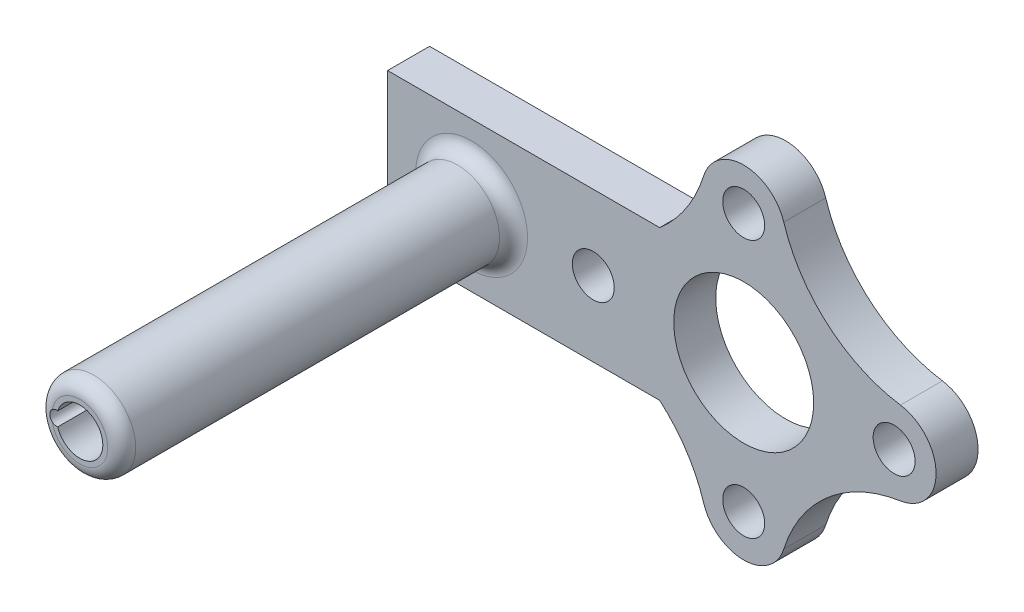
from build123d import *

# Parameters (mm, degrees)
SKETCH1_R                = 1.5
SKETCH1_R_2              = 5
SKETCH1_R_3              = 3
BOSS_EXTRUDE1_DEPTH      = 3
SKETCH2_W                = 19.444746102
SKETCH2_H                = 10.693884422
SKETCH2_R                = 3
SKETCH2_R_2              = 1.5
BOSS_EXTRUDE2_DEPTH      = 3
BOSS_EXTRUDE3_DEPTH      = 28
BOSS_EXTRUDE3_DEPTH_BACK = 3
SKETCH3_R                = 3
SKETCH3_R_2              = 1.65
SKETCH4_R                = 0.5
CUT_EXTRUDE1_DEPTH       = 30
SKETCH5_R                = 3
CUT_EXTRUDE2_DEPTH       = 2
CHAMFER1_SIZE            = 1
FILLET2_R                = 1
FILLET3_R                = 1


with BuildPart() as part:
    # Sketch1 → Boss-Extrude1 (new body)
    # profile 1 of 4: a face of its own
    with BuildSketch(Plane.XY):
        with BuildLine():
            ThreePointArc((2.863548114, 10.119478732), (2.965690842, 9.677413339), (3, 9.225))
            ThreePointArc((3, 9.225), (-0.452413339, 6.259309158), (-2.863548114, 10.119478732))
            ThreePointArc((-2.863548114, 10.119478732), (-6.005253898, 5.346942211), (-11.199408085, 2.966147733))
            ThreePointArc((-11.199408085, 2.966147733), (-8.794012303, 2.274667476), (-7.75, 0))
            ThreePointArc((-7.75, 0), (-8.794012303, -2.274667476), (-11.199408085, -2.966147733))
            ThreePointArc((-11.199408085, -2.966147733), (-6.005253898, -5.346942211), (-2.863548114, -10.119478732))
            ThreePointArc((-2.863548114, -10.119478732), (0, -12.225), (2.863548114, -10.119478732))
            ThreePointArc((2.863548114, -10.119478732), (6.005253898, -5.346942211), (11.199408085, -2.966147733))
            ThreePointArc((11.199408085, -2.966147733), (7.75, 0), (11.199408085, 2.966147733))
            ThreePointArc((11.199408085, 2.966147733), (6.005253898, 5.346942211), (2.863548114, 10.119478732))
        make_face()
        with Locations((0, -9.225)):
            Circle(SKETCH1_R, mode=Mode.SUBTRACT)
        Circle(SKETCH1_R_2, mode=Mode.SUBTRACT)
    # profile 2 of 4: a face of its own
    with BuildSketch(Plane.XY):
        with Locations((0, 9.225)):
            Circle(SKETCH1_R_3)
        with Locations((0, 9.225)):
            Circle(SKETCH1_R, mode=Mode.SUBTRACT)
    # profile 3 of 4: a face of its own
    with BuildSketch(Plane.XY):
        with Locations((-10.75, 0)):
            Circle(SKETCH1_R_3)
        with Locations((-10.75, 0)):
            Circle(SKETCH1_R, mode=Mode.SUBTRACT)
    # profile 4 of 4: a face of its own
    with BuildSketch(Plane.XY):
        with Locations((10.75, 0)):
            Circle(SKETCH1_R_3)
        with Locations((10.75, 0)):
            Circle(SKETCH1_R, mode=Mode.SUBTRACT)
    extrude(amount=BOSS_EXTRUDE1_DEPTH)

    # Sketch2 → Boss-Extrude2 (add, through all)
    with BuildSketch(Plane(origin=(0, 0, 0), x_dir=(-1, 0, 0), z_dir=(0, 0, -1))):
        with Locations((15.727626949, 0)):
            Rectangle(SKETCH2_W, SKETCH2_H)
        with Locations((19.45, 0)):
            Circle(SKETCH2_R, mode=Mode.SUBTRACT)
        with Locations(Location((10.75, 0, 0), (0, 0, 180))):
            Circle(SKETCH2_R_2, mode=Mode.SUBTRACT)
    extrude(amount=-BOSS_EXTRUDE2_DEPTH)

    # Sketch3 → Boss-Extrude3 (add, two sides: drawn at the far end of the back side and taken through both)
    with BuildSketch(Plane.XY.offset(3).offset(-BOSS_EXTRUDE3_DEPTH_BACK)):
        with Locations((-19.45, 0)):
            Circle(SKETCH3_R)
        with Locations((-19.45, 0)):
            Circle(SKETCH3_R_2, mode=Mode.SUBTRACT)
    extrude(amount=BOSS_EXTRUDE3_DEPTH + BOSS_EXTRUDE3_DEPTH_BACK)

    # Sketch4 → Cut-Extrude1 (cut)
    with BuildSketch(Plane.XY.offset(31)):
        with Locations((-21.1, 0)):
            Circle(SKETCH4_R)
    extrude(amount=-CUT_EXTRUDE1_DEPTH, mode=Mode.SUBTRACT)

    # Sketch5 → Cut-Extrude2 (cut)
    with BuildSketch(Plane(origin=(0, 0, 0), x_dir=(-1, 0, 0), z_dir=(0, 0, -1))):
        with Locations(Location((19.45, 0, 0), (0, 0, 180))):
            Circle(SKETCH5_R)
    extrude(amount=-CUT_EXTRUDE2_DEPTH, mode=Mode.SUBTRACT)

    # Chamfer1
    # the kernel refuses this chamfer: 1 mm, written as the material it adds along each edge
    with BuildSketch(Plane(origin=(-19.45, 0, 2), x_dir=(1, 0, 0), z_dir=(0, 1, 0))) as chamfer1_piece_1_section:
        Polygon((3 - CHAMFER1_SIZE, 0), (3, CHAMFER1_SIZE), (3, 0), align=None)
    chamfer1_piece_1 = revolve(axis=Axis((-19.45, 0, 2), (0, 0, -1)), mode=Mode.PRIVATE)
    chamfer1_piece_1 = chamfer1_piece_1 - Plane(origin=(-21.1, 0, 1.51482841), x_dir=(1, 0, 0), z_dir=(0, 0, 1)) * Cylinder(0.5, 12, mode=Mode.PRIVATE)
    add(chamfer1_piece_1)

    # Fillet2
    fillet2_edges = [part.edges().sort_by_distance(p)[0] for p in [
        (-22.45, 0, 3),
    ]]
    fillet(fillet2_edges, radius=FILLET2_R)

    # Fillet3
    # the kernel refuses this fillet: 1 mm, written as the material it takes off along each edge
    with BuildSketch(Plane(origin=(-19.45, 0, 31), x_dir=(1, 0, 0), z_dir=(0, -1, 0))) as fillet3_piece_1:
        with BuildLine():
            CenterArc((3 - FILLET3_R, -FILLET3_R), FILLET3_R, 0, 90)
            Line((3 - FILLET3_R, 0), (3, 0))
            Line((3, 0), (3, -FILLET3_R))
        make_face()
    revolve(axis=Axis((-19.45, 0, 31), (0, 0, 1)), mode=Mode.SUBTRACT)


solid = part.part
